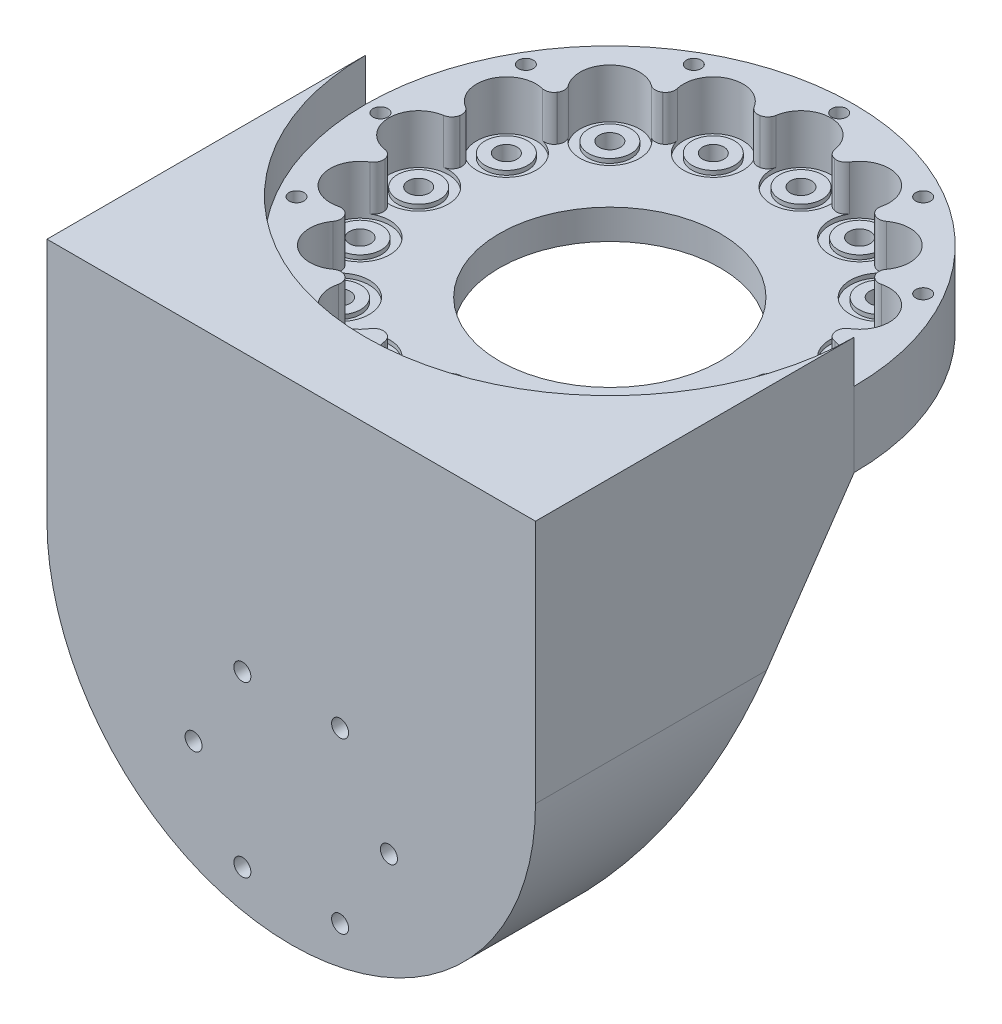
from build123d import *
from build123d.topology import SkipClean

# Parameters (mm, degrees)
SKETCH1_R           = 2.5
SKETCH1_R_2         = 1.75
SKETCH1_R_3         = 26
BOSS_EXTRUDE1_DEPTH = 7
SKETCH3_R           = 1.75
BOSS_EXTRUDE2_DEPTH = 10.6
CUT_EXTRUDE1_START  = -1
SKETCH2_R           = 7
SKETCH2_R_2         = 5
CUT_EXTRUDE1_DEPTH  = 1
FILLET2_R           = 2.3
BOSS_EXTRUDE3_DEPTH = 115
SKETCH6_R           = 57.5
CUT_EXTRUDE2_DEPTH  = 87.5
CUT_EXTRUDE3_START  = -10
SKETCH8_R           = 57.5
CUT_EXTRUDE3_DEPTH  = 10
SKETCH9_R           = 2
CUT_EXTRUDE5_DEPTH  = 50
FILLET3_R           = 57.5
SKETCH10_R          = 4.25
CUT_EXTRUDE6_DEPTH  = 60


# Some blends are built 0.0001 mm under size
with BuildPart() as part:
    # Sketch1 → Boss-Extrude1 (new body)
    with BuildSketch(Plane(origin=(0, 0, 0), x_dir=(1, 0, 0), z_dir=(0, 1, 0))):
        with BuildLine():
            ThreePointArc((57.5, 0), (0, 57.5), (-57.5, 0))
            Line((-57.5, 0), (-57.5, -60))
            Line((-57.5, -60), (57.5, -60))
            Line((57.5, -60), (57.5, 0))
        make_face()
        with Locations(Location((-31.819805153, -31.819805153, 0), (0, 0, 270))):
            Circle(SKETCH1_R, mode=Mode.SUBTRACT)
        with Locations(Location((-27, -46.765371804, 0), (0, 0, 270))):
            Circle(SKETCH1_R_2, mode=Mode.SUBTRACT)
        with Locations(Location((-17.220754456, -41.574578963, 0), (0, 0, 270))):
            Circle(SKETCH1_R, mode=Mode.SUBTRACT)
        with Locations(Location((-46.765371804, -27, 0), (0, 0, 270))):
            Circle(SKETCH1_R_2, mode=Mode.SUBTRACT)
        with Locations(Location((-41.574578963, -17.220754456, 0), (0, 0, 270))):
            Circle(SKETCH1_R, mode=Mode.SUBTRACT)
        with Locations(Location((0, -54, 0), (0, 0, 270))):
            Circle(SKETCH1_R_2, mode=Mode.SUBTRACT)
        with Locations(Location((27, -46.765371804, 0), (0, 0, 270))):
            Circle(SKETCH1_R_2, mode=Mode.SUBTRACT)
        with Locations(Location((0, -45, 0), (0, 0, 270))):
            Circle(SKETCH1_R, mode=Mode.SUBTRACT)
        with Locations(Location((17.220754456, -41.574578963, 0), (0, 0, 270))):
            Circle(SKETCH1_R, mode=Mode.SUBTRACT)
        with Locations(Location((31.819805153, -31.819805153, 0), (0, 0, 270))):
            Circle(SKETCH1_R, mode=Mode.SUBTRACT)
        with Locations(Location((41.574578963, -17.220754456, 0), (0, 0, 270))):
            Circle(SKETCH1_R, mode=Mode.SUBTRACT)
        with Locations(Location((46.765371804, -27, 0), (0, 0, 270))):
            Circle(SKETCH1_R_2, mode=Mode.SUBTRACT)
        with Locations(Location((-54, 0, 0), (0, 0, 270))):
            Circle(SKETCH1_R_2, mode=Mode.SUBTRACT)
        with Locations(Location((-45, 0, 0), (0, 0, 270))):
            Circle(SKETCH1_R, mode=Mode.SUBTRACT)
        with Locations(Location((-46.765371804, 27, 0), (0, 0, 270))):
            Circle(SKETCH1_R_2, mode=Mode.SUBTRACT)
        with Locations(Location((-41.574578963, 17.220754456, 0), (0, 0, 270))):
            Circle(SKETCH1_R, mode=Mode.SUBTRACT)
        with Locations(Location((-31.819805153, 31.819805153, 0), (0, 0, 270))):
            Circle(SKETCH1_R, mode=Mode.SUBTRACT)
        with Locations(Location((-17.220754456, 41.574578963, 0), (0, 0, 270))):
            Circle(SKETCH1_R, mode=Mode.SUBTRACT)
        with Locations(Location((-27, 46.765371804, 0), (0, 0, 270))):
            Circle(SKETCH1_R_2, mode=Mode.SUBTRACT)
        with Locations(Location((0, 0, 0), (0, 0, 270))):
            Circle(SKETCH1_R_3, mode=Mode.SUBTRACT)
        with Locations(Location((45, 0, 0), (0, 0, 270))):
            Circle(SKETCH1_R, mode=Mode.SUBTRACT)
        with Locations(Location((54, 0, 0), (0, 0, 270))):
            Circle(SKETCH1_R_2, mode=Mode.SUBTRACT)
        with Locations(Location((41.574578963, 17.220754456, 0), (0, 0, 270))):
            Circle(SKETCH1_R, mode=Mode.SUBTRACT)
        with Locations(Location((46.765371804, 27, 0), (0, 0, 270))):
            Circle(SKETCH1_R_2, mode=Mode.SUBTRACT)
        with Locations(Location((17.220754456, 41.574578963, 0), (0, 0, 270))):
            Circle(SKETCH1_R, mode=Mode.SUBTRACT)
        with Locations(Location((0, 45, 0), (0, 0, 270))):
            Circle(SKETCH1_R, mode=Mode.SUBTRACT)
        with Locations(Location((0, 54, 0), (0, 0, 270))):
            Circle(SKETCH1_R_2, mode=Mode.SUBTRACT)
        with Locations(Location((27, 46.765371804, 0), (0, 0, 270))):
            Circle(SKETCH1_R_2, mode=Mode.SUBTRACT)
        with Locations(Location((31.819805153, 31.819805153, 0), (0, 0, 270))):
            Circle(SKETCH1_R, mode=Mode.SUBTRACT)
    extrude(amount=BOSS_EXTRUDE1_DEPTH)

    # Sketch3 → Boss-Extrude2 (add)
    with BuildSketch(Plane(origin=(0, 7, 0), x_dir=(1, 0, 0), z_dir=(0, 1, 0))):
        with BuildLine():
            Line((57.5, -60), (57.5, 0))
            ThreePointArc((57.5, 0), (0, 57.5), (-57.5, 0))
            Line((-57.5, 0), (-57.5, -60))
            Line((-57.5, -60), (57.5, -60))
        make_face()
        with Locations(Location((27, 46.765371804, 0), (0, 0, 270))):
            Circle(SKETCH3_R, mode=Mode.SUBTRACT)
        with Locations(Location((-27, -46.765371804, 0), (0, 0, 270))):
            Circle(SKETCH3_R, mode=Mode.SUBTRACT)
        with Locations(Location((-46.765371804, -27, 0), (0, 0, 270))):
            Circle(SKETCH3_R, mode=Mode.SUBTRACT)
        with Locations(Location((0, -54, 0), (0, 0, 270))):
            Circle(SKETCH3_R, mode=Mode.SUBTRACT)
        with Locations(Location((27, -46.765371804, 0), (0, 0, 270))):
            Circle(SKETCH3_R, mode=Mode.SUBTRACT)
        with Locations(Location((46.765371804, -27, 0), (0, 0, 270))):
            Circle(SKETCH3_R, mode=Mode.SUBTRACT)
        with Locations(Location((-54, 0, 0), (0, 0, 270))):
            Circle(SKETCH3_R, mode=Mode.SUBTRACT)
        with Locations(Location((-46.765371804, 27, 0), (0, 0, 270))):
            Circle(SKETCH3_R, mode=Mode.SUBTRACT)
        with Locations(Location((-27, 46.765371804, 0), (0, 0, 270))):
            Circle(SKETCH3_R, mode=Mode.SUBTRACT)
        with BuildLine():
            ThreePointArc((43.742247125, 10.564838686), (44.135337618, 8.779064491), (44.455555556, 6.978795043))
            ThreePointArc((44.455555556, 6.978795043), (52, 0), (44.455555556, -6.978795043))
            ThreePointArc((44.455555556, -6.978795043), (44.135337618, -8.779064491), (43.742247125, -10.564838686))
            ThreePointArc((43.742247125, -10.564838686), (48.041735691, -19.899538483), (38.400908644, -23.459970489))
            ThreePointArc((38.400908644, -23.459970489), (37.416132554, -25.000660486), (36.369578094, -26.500071496))
            ThreePointArc((36.369578094, -26.500071496), (36.769552622, -36.769552622), (26.500071496, -36.369578094))
            ThreePointArc((26.500071496, -36.369578094), (25.000660486, -37.416132554), (23.459970489, -38.400908644))
            ThreePointArc((23.459970489, -38.400908644), (19.899538483, -48.041735691), (10.564838686, -43.742247125))
            ThreePointArc((10.564838686, -43.742247125), (8.779064491, -44.135337618), (6.978795043, -44.455555556))
            ThreePointArc((6.978795043, -44.455555556), (0, -52), (-6.978795043, -44.455555556))
            ThreePointArc((-6.978795043, -44.455555556), (-8.779064491, -44.135337618), (-10.564838686, -43.742247125))
            ThreePointArc((-10.564838686, -43.742247125), (-19.899538483, -48.041735691), (-23.459970489, -38.400908644))
            ThreePointArc((-23.459970489, -38.400908644), (-25.000660486, -37.416132554), (-26.500071496, -36.369578094))
            ThreePointArc((-26.500071496, -36.369578094), (-36.769552622, -36.769552622), (-36.369578094, -26.500071496))
            ThreePointArc((-36.369578094, -26.500071496), (-37.416132554, -25.000660486), (-38.400908644, -23.459970489))
            ThreePointArc((-38.400908644, -23.459970489), (-48.041735691, -19.899538483), (-43.742247125, -10.564838686))
            ThreePointArc((-43.742247125, -10.564838686), (-44.135337618, -8.779064491), (-44.455555556, -6.978795043))
            ThreePointArc((-44.455555556, -6.978795043), (-52, 0), (-44.455555556, 6.978795043))
            ThreePointArc((-44.455555556, 6.978795043), (-44.135337618, 8.779064491), (-43.742247125, 10.564838686))
            ThreePointArc((-43.742247125, 10.564838686), (-48.041735691, 19.899538483), (-38.400908644, 23.459970489))
            ThreePointArc((-38.400908644, 23.459970489), (-37.416132554, 25.000660486), (-36.369578094, 26.500071496))
            ThreePointArc((-36.369578094, 26.500071496), (-36.769552622, 36.769552622), (-26.500071496, 36.369578094))
            ThreePointArc((-26.500071496, 36.369578094), (-25.000660486, 37.416132554), (-23.459970489, 38.400908644))
            ThreePointArc((-23.459970489, 38.400908644), (-19.899538483, 48.041735691), (-10.564838686, 43.742247125))
            ThreePointArc((-10.564838686, 43.742247125), (-8.779064491, 44.135337618), (-6.978795043, 44.455555556))
            ThreePointArc((-6.978795043, 44.455555556), (0, 52), (6.978795043, 44.455555556))
            ThreePointArc((6.978795043, 44.455555556), (8.779064491, 44.135337618), (10.564838686, 43.742247125))
            ThreePointArc((10.564838686, 43.742247125), (19.899538483, 48.041735691), (23.459970489, 38.400908644))
            ThreePointArc((23.459970489, 38.400908644), (25.000660486, 37.416132554), (26.500071496, 36.369578094))
            ThreePointArc((26.500071496, 36.369578094), (36.769552622, 36.769552622), (36.369578094, 26.500071496))
            ThreePointArc((36.369578094, 26.500071496), (37.416132554, 25.000660486), (38.400908644, 23.459970489))
            ThreePointArc((38.400908644, 23.459970489), (48.041735691, 19.899538483), (43.742247125, 10.564838686))
        make_face(mode=Mode.SUBTRACT)
        with Locations(Location((54, 0, 0), (0, 0, 270))):
            Circle(SKETCH3_R, mode=Mode.SUBTRACT)
        with Locations(Location((46.765371804, 27, 0), (0, 0, 270))):
            Circle(SKETCH3_R, mode=Mode.SUBTRACT)
        with Locations(Location((0, 54, 0), (0, 0, 270))):
            Circle(SKETCH3_R, mode=Mode.SUBTRACT)
    extrude(amount=BOSS_EXTRUDE2_DEPTH)

    # Sketch2 → Cut-Extrude1 (cut)
    # profile 1 of 16: a face of its own
    with SkipClean():  # the faces are left unmerged after this step: merging them gives an invalid solid
        with BuildSketch(Plane(origin=(0, 7, 0), x_dir=(1, 0, 0), z_dir=(0, 1, 0)).offset(CUT_EXTRUDE1_START)):
            with Locations(Location((0, 45, 0), (0, 0, 184.460843698))):
                Circle(SKETCH2_R)
            with Locations(Location((0, 45, 0), (0, 0, 270))):
                Circle(SKETCH2_R_2, mode=Mode.SUBTRACT)
        # profile 2 of 16: a face of its own
        with BuildSketch(Plane(origin=(0, 7, 0), x_dir=(1, 0, 0), z_dir=(0, 1, 0)).offset(CUT_EXTRUDE1_START)):
            with Locations(Location((17.220754456, 41.574578963, 0), (0, 0, 161.960843698))):
                Circle(SKETCH2_R)
            with Locations(Location((17.220754456, 41.574578963, 0), (0, 0, 270))):
                Circle(SKETCH2_R_2, mode=Mode.SUBTRACT)
        # profile 3 of 16: a face of its own
        with BuildSketch(Plane(origin=(0, 7, 0), x_dir=(1, 0, 0), z_dir=(0, 1, 0)).offset(CUT_EXTRUDE1_START)):
            with Locations(Location((31.819805153, 31.819805153, 0), (0, 0, 139.460843698))):
                Circle(SKETCH2_R)
            with Locations(Location((31.819805153, 31.819805153, 0), (0, 0, 270))):
                Circle(SKETCH2_R_2, mode=Mode.SUBTRACT)
        # profile 4 of 16: a face of its own
        with BuildSketch(Plane(origin=(0, 7, 0), x_dir=(1, 0, 0), z_dir=(0, 1, 0)).offset(CUT_EXTRUDE1_START)):
            with Locations(Location((41.574578963, 17.220754456, 0), (0, 0, 116.960843698))):
                Circle(SKETCH2_R)
            with Locations(Location((41.574578963, 17.220754456, 0), (0, 0, 270))):
                Circle(SKETCH2_R_2, mode=Mode.SUBTRACT)
        # profile 5 of 16: a face of its own
        with BuildSketch(Plane(origin=(0, 7, 0), x_dir=(1, 0, 0), z_dir=(0, 1, 0)).offset(CUT_EXTRUDE1_START)):
            with Locations(Location((45, 0, 0), (0, 0, 94.460843698))):
                Circle(SKETCH2_R)
            with Locations(Location((45, 0, 0), (0, 0, 270))):
                Circle(SKETCH2_R_2, mode=Mode.SUBTRACT)
        # profile 6 of 16: a face of its own
        with BuildSketch(Plane(origin=(0, 7, 0), x_dir=(1, 0, 0), z_dir=(0, 1, 0)).offset(CUT_EXTRUDE1_START)):
            with Locations(Location((41.574578963, -17.220754456, 0), (0, 0, 71.960843698))):
                Circle(SKETCH2_R)
            with Locations(Location((41.574578963, -17.220754456, 0), (0, 0, 270))):
                Circle(SKETCH2_R_2, mode=Mode.SUBTRACT)
        # profile 7 of 16: a face of its own
        with BuildSketch(Plane(origin=(0, 7, 0), x_dir=(1, 0, 0), z_dir=(0, 1, 0)).offset(CUT_EXTRUDE1_START)):
            with Locations(Location((31.819805153, -31.819805153, 0), (0, 0, 49.460843698))):
                Circle(SKETCH2_R)
            with Locations(Location((31.819805153, -31.819805153, 0), (0, 0, 270))):
                Circle(SKETCH2_R_2, mode=Mode.SUBTRACT)
        # profile 8 of 16: a face of its own
        with BuildSketch(Plane(origin=(0, 7, 0), x_dir=(1, 0, 0), z_dir=(0, 1, 0)).offset(CUT_EXTRUDE1_START)):
            with Locations(Location((17.220754456, -41.574578963, 0), (0, 0, 26.960843698))):
                Circle(SKETCH2_R)
            with Locations(Location((17.220754456, -41.574578963, 0), (0, 0, 270))):
                Circle(SKETCH2_R_2, mode=Mode.SUBTRACT)
        # profile 9 of 16: a face of its own
        with BuildSketch(Plane(origin=(0, 7, 0), x_dir=(1, 0, 0), z_dir=(0, 1, 0)).offset(CUT_EXTRUDE1_START)):
            with Locations(Location((0, -45, 0), (0, 0, 175.539156302))):
                Circle(SKETCH2_R)
            with Locations(Location((0, -45, 0), (0, 0, 270))):
                Circle(SKETCH2_R_2, mode=Mode.SUBTRACT)
        # profile 10 of 16: a face of its own
        with BuildSketch(Plane(origin=(0, 7, 0), x_dir=(1, 0, 0), z_dir=(0, 1, 0)).offset(CUT_EXTRUDE1_START)):
            with Locations(Location((-17.220754456, -41.574578963, 0), (0, 0, 153.039156302))):
                Circle(SKETCH2_R)
            with Locations(Location((-17.220754456, -41.574578963, 0), (0, 0, 270))):
                Circle(SKETCH2_R_2, mode=Mode.SUBTRACT)
        # profile 11 of 16: a face of its own
        with BuildSketch(Plane(origin=(0, 7, 0), x_dir=(1, 0, 0), z_dir=(0, 1, 0)).offset(CUT_EXTRUDE1_START)):
            with Locations(Location((-31.819805153, -31.819805153, 0), (0, 0, 130.539156302))):
                Circle(SKETCH2_R)
            with Locations(Location((-31.819805153, -31.819805153, 0), (0, 0, 270))):
                Circle(SKETCH2_R_2, mode=Mode.SUBTRACT)
        # profile 12 of 16: a face of its own
        with BuildSketch(Plane(origin=(0, 7, 0), x_dir=(1, 0, 0), z_dir=(0, 1, 0)).offset(CUT_EXTRUDE1_START)):
            with Locations(Location((-41.574578963, -17.220754456, 0), (0, 0, 108.039156302))):
                Circle(SKETCH2_R)
            with Locations(Location((-41.574578963, -17.220754456, 0), (0, 0, 270))):
                Circle(SKETCH2_R_2, mode=Mode.SUBTRACT)
        # profile 13 of 16: a face of its own
        with BuildSketch(Plane(origin=(0, 7, 0), x_dir=(1, 0, 0), z_dir=(0, 1, 0)).offset(CUT_EXTRUDE1_START)):
            with Locations(Location((-45, 0, 0), (0, 0, 85.539156302))):
                Circle(SKETCH2_R)
            with Locations(Location((-45, 0, 0), (0, 0, 270))):
                Circle(SKETCH2_R_2, mode=Mode.SUBTRACT)
        # profile 14 of 16: a face of its own
        with BuildSketch(Plane(origin=(0, 7, 0), x_dir=(1, 0, 0), z_dir=(0, 1, 0)).offset(CUT_EXTRUDE1_START)):
            with Locations(Location((-41.574578963, 17.220754456, 0), (0, 0, 63.039156302))):
                Circle(SKETCH2_R)
            with Locations(Location((-41.574578963, 17.220754456, 0), (0, 0, 270))):
                Circle(SKETCH2_R_2, mode=Mode.SUBTRACT)
        # profile 15 of 16: a face of its own
        with BuildSketch(Plane(origin=(0, 7, 0), x_dir=(1, 0, 0), z_dir=(0, 1, 0)).offset(CUT_EXTRUDE1_START)):
            with Locations(Location((-31.819805153, 31.819805153, 0), (0, 0, 40.539156302))):
                Circle(SKETCH2_R)
            with Locations(Location((-31.819805153, 31.819805153, 0), (0, 0, 270))):
                Circle(SKETCH2_R_2, mode=Mode.SUBTRACT)
        # profile 16 of 16: a face of its own
        with BuildSketch(Plane(origin=(0, 7, 0), x_dir=(1, 0, 0), z_dir=(0, 1, 0)).offset(CUT_EXTRUDE1_START)):
            with Locations(Location((-17.220754456, 41.574578963, 0), (0, 0, 18.039156302))):
                Circle(SKETCH2_R)
            with Locations(Location((-17.220754456, 41.574578963, 0), (0, 0, 270))):
                Circle(SKETCH2_R_2, mode=Mode.SUBTRACT)
        extrude(amount=CUT_EXTRUDE1_DEPTH, mode=Mode.SUBTRACT)

    # Fillet2
    # the kernel refuses this fillet: 2.3 mm, written as the material it takes off along each edge
    with BuildSketch(Plane(origin=(-23.459970489, 7, -38.400908644), x_dir=(-0.8427793753545282, 0, 0.5382591610711623), z_dir=(0, 1, 0)), Plane(origin=(-6.978795043, 7, -44.455555556), x_dir=(-0.9846094785733607, 0, 0.17476891801317154), z_dir=(0, 1, 0)), Plane(origin=(10.564838686, 7, -43.742247125), x_dir=(-0.9765417141865547, 0, -0.21532830852812912), z_dir=(0, 1, 0)), Plane(origin=(26.500071496, 7, -36.369578094), x_dir=(-0.8198043261875663, 0, -0.5726437520519633), z_dir=(0, 1, 0)), Plane(origin=(38.400908644, 7, -23.459970489), x_dir=(-0.5382591610712182, 0, -0.8427793753544924), z_dir=(0, 1, 0)), Plane(origin=(44.455555556, 7, -6.978795043), x_dir=(-0.17476891801324426, 0, -0.9846094785733478), z_dir=(0, 1, 0)), Plane(origin=(43.742247125, 7, 10.564838686), x_dir=(0.21532830852806029, 0, -0.97654171418657), z_dir=(0, 1, 0)), Plane(origin=(36.369578094, 7, 26.500071496), x_dir=(0.5726437520519656, 0, -0.8198043261875646), z_dir=(0, 1, 0)), Plane(origin=(23.459970489, 7, 38.400908644), x_dir=(0.8427793753545069, 0, -0.5382591610711956), z_dir=(0, 1, 0)), Plane(origin=(6.978795043, 7, 44.455555556), x_dir=(0.9846094785733598, 0, -0.17476891801317637), z_dir=(0, 1, 0)), Plane(origin=(-10.564838686, 7, 43.742247125), x_dir=(0.9765417141865467, 0, 0.21532830852816587), z_dir=(0, 1, 0)), Plane(origin=(-26.500071496, 7, 36.369578094), x_dir=(0.8198043261875152, 0, 0.5726437520520364), z_dir=(0, 1, 0)), Plane(origin=(-38.400908644, 7, 23.459970489), x_dir=(0.5382591610711249, 0, 0.8427793753545519), z_dir=(0, 1, 0)), Plane(origin=(-44.455555556, 7, 6.978795043), x_dir=(0.17476891801311809, 0, 0.9846094785733702), z_dir=(0, 1, 0)), Plane(origin=(-43.742247125, 7, -10.564838686), x_dir=(-0.21532830852818743, 0, 0.9765417141865419), z_dir=(0, 1, 0))) as fillet2_piece_1:
        with BuildLine():
            CenterArc((1.842024118, -2.299541934), FILLET2_R, 91.143523453, 70.14702947)
            ThreePointArc((-0.336437905, -1.561772855), (-0.123517809, -0.790515971), (0, 0))
            ThreePointArc((0, 0), (0.898061596, -0.008962166), (1.796123192, 0))
        make_face()
    extrude(amount=15.090307981, mode=Mode.SUBTRACT)
    with BuildSketch(Plane(origin=(-10.564838686, 7, -43.742247125), x_dir=(-0.41614901455552533, 0, -0.909296430040537), z_dir=(0, 1, 0)), Plane(origin=(6.978795043, 7, -44.455555556), x_dir=(-0.03649887813743222, 0, -0.9993336939654887), z_dir=(0, 1, 0)), Plane(origin=(23.459970489, 7, -38.400908644), x_dir=(0.34870788161402416, 0, -0.9372314619667116), z_dir=(0, 1, 0)), Plane(origin=(36.369578094, 7, -26.500071496), x_dir=(0.6808270274345865, 0, -0.7324442359078163), z_dir=(0, 1, 0)), Plane(origin=(43.742247125, 7, -10.564838686), x_dir=(0.9092964300405019, 0, -0.41614901455560216), z_dir=(0, 1, 0)), Plane(origin=(44.455555556, 7, 6.978795043), x_dir=(0.9993336939654818, 0, -0.03649887813762044), z_dir=(0, 1, 0)), Plane(origin=(38.400908644, 7, 23.459970489), x_dir=(0.9372314619668524, 0, 0.34870788161364596), z_dir=(0, 1, 0)), Plane(origin=(26.500071496, 7, 36.369578094), x_dir=(0.7324442359079953, 0, 0.6808270274343937), z_dir=(0, 1, 0)), Plane(origin=(10.564838686, 7, 43.742247125), x_dir=(0.416149014555875, 0, 0.909296430040377), z_dir=(0, 1, 0)), Plane(origin=(-6.978795043, 7, 44.455555556), x_dir=(0.03649887813780143, 0, 0.9993336939654751), z_dir=(0, 1, 0)), Plane(origin=(-23.459970489, 7, 38.400908644), x_dir=(-0.3487078816136978, 0, 0.937231461966833), z_dir=(0, 1, 0)), Plane(origin=(-36.369578094, 7, 26.500071496), x_dir=(-0.6808270274344342, 0, 0.7324442359079577), z_dir=(0, 1, 0)), Plane(origin=(-43.742247125, 7, 10.564838686), x_dir=(-0.9092964300404409, 0, 0.41614901455573555), z_dir=(0, 1, 0)), Plane(origin=(-44.455555556, 7, -6.978795043), x_dir=(-0.9993336939654848, 0, 0.036498878137536744), z_dir=(0, 1, 0)), Plane(origin=(-38.400908644, 7, -23.459970489), x_dir=(-0.9372314619667373, 0, -0.3487078816139551), z_dir=(0, 1, 0)), Plane(origin=(-26.500071496, 7, -36.369578094), x_dir=(-0.7324442359077771, 0, -0.6808270274346288), z_dir=(0, 1, 0))) as fillet2_piece_2:
        with BuildLine():
            CenterArc((1.860062549, -2.284975552), FILLET2_R, 96.552539963, 70.14702947)
            ThreePointArc((-0.378244882, -1.755844336), (-0.180361256, -0.879809507), (0, 0))
            ThreePointArc((0, 0), (0.798799868, -0.045726582), (1.597599735, 0))
        make_face()
    extrude(amount=15.090307981, mode=Mode.SUBTRACT)
    with BuildSketch(Plane(origin=(-36.369578094, 7, -26.500071496), x_dir=(-0.6808270274345974, 0, -0.732444235907806), z_dir=(0, 1, 0))) as fillet2_piece_3:
        with BuildLine():
            CenterArc((1.860062549, 2.284975552), FILLET2_R, 193.300430567, 70.14702947)
            ThreePointArc((-0.378244882, 1.755844336), (-0.180361256, 0.879809507), (0, 0))
            ThreePointArc((0, 0), (0.798799868, 0.045726582), (1.597599735, 0))
        make_face()
    extrude(amount=15.090307981, mode=Mode.SUBTRACT)

    # Sketch5 → Boss-Extrude3 (add)
    with BuildSketch(Plane(origin=(57.5, 0, 0), x_dir=(0, 0, -1), z_dir=(1, 0, 0))):
        Polygon((-60, 17.6), (0, 17.6), (0, 27.6), (-75, 27.6), (-75, -87.5), (-60, -87.5), (0, 0), (-60, 0), align=None)
    extrude(amount=-BOSS_EXTRUDE3_DEPTH)

    # Sketch6 → Cut-Extrude2 (cut)
    with BuildSketch(Plane.XZ.offset(87.5)):
        Circle(SKETCH6_R)
    extrude(amount=-CUT_EXTRUDE2_DEPTH, mode=Mode.SUBTRACT)

    # Sketch8 → Cut-Extrude3 (cut)
    with BuildSketch(Plane(origin=(0, 27.6, 0), x_dir=(1, 0, 0), z_dir=(0, 1, 0)).offset(CUT_EXTRUDE3_START)):
        Circle(SKETCH8_R)
    extrude(amount=CUT_EXTRUDE3_DEPTH, mode=Mode.SUBTRACT)

    # Sketch9 → Cut-Extrude5 (cut)
    with BuildSketch(Plane.XY.offset(75)):
        with Locations((23, -57.5)):
            Circle(SKETCH9_R)
        with Locations((11.5, -77.418584287)):
            Circle(SKETCH9_R)
        with Locations((-11.5, -77.418584287)):
            Circle(SKETCH9_R)
        with Locations((-23, -57.5)):
            Circle(SKETCH9_R)
        with Locations((-11.5, -37.581415713)):
            Circle(SKETCH9_R)
        with Locations((11.5, -37.581415713)):
            Circle(SKETCH9_R)
    extrude(amount=-CUT_EXTRUDE5_DEPTH, mode=Mode.SUBTRACT)

    # Fillet3
    fillet3_edges = [part.edges().sort_by_distance(p)[0] for p in [
        (57.5, -87.5, 67.5),
        (-57.5, -87.5, 67.5),
    ]]
    fillet(fillet3_edges, radius=FILLET3_R - 0.0001)  # a hair under: the kernel refuses the full size

    # Sketch10 → Cut-Extrude6 (cut)
    with BuildSketch(Plane.XY):
        with Locations(Location((23, -57.5, 0), (0, 0, 180))):
            Circle(SKETCH10_R)
        with Locations(Location((11.5, -77.418584287, 0), (0, 0, 180))):
            Circle(SKETCH10_R)
        with Locations(Location((-11.5, -77.418584287, 0), (0, 0, 180))):
            Circle(SKETCH10_R)
        with Locations(Location((-23, -57.5, 0), (0, 0, 180))):
            Circle(SKETCH10_R)
        with Locations(Location((-11.5, -37.581415713, 0), (0, 0, 180))):
            Circle(SKETCH10_R)
        with Locations(Location((11.5, -37.581415713, 0), (0, 0, 180))):
            Circle(SKETCH10_R)
    extrude(amount=CUT_EXTRUDE6_DEPTH, mode=Mode.SUBTRACT)


solid = part.part
